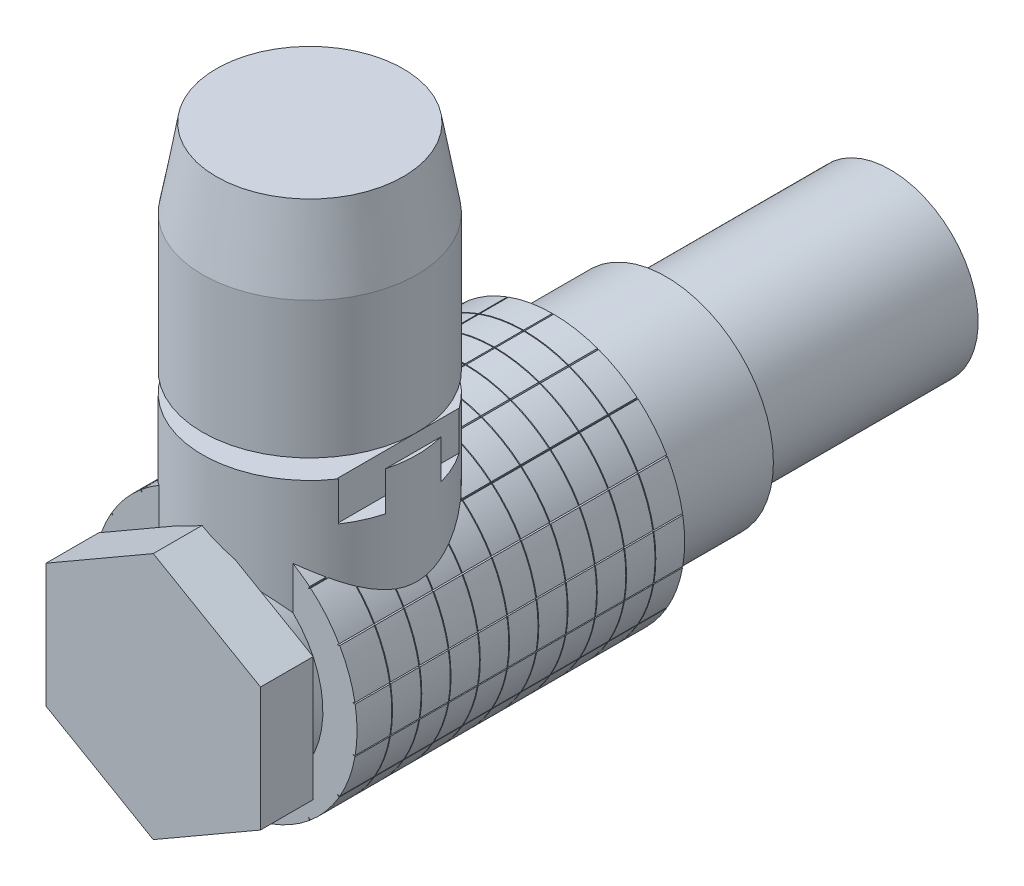
from build123d import *

# Parameters (mm, degrees)
ESQUISSE1_R                  = 6.75
EXTRUSION1_DEPTH             = 16.8
ESQUISSE2_R                  = 5.5
EXTRUSION2_DEPTH             = 5.8
ESQUISSE3_R                  = 4.5
EXTRUSION3_DEPTH             = 11.5
EXTRUSION4_DEPTH             = 20.758922035
R_P_TITION_CIRCULAIRE1_COUNT = 18
R_P_TITION_LIN_AIRE1_COUNT   = 10
R_P_TITION_LIN_AIRE1_PITCH   = 1.5
ESQUISSE6_R                  = 4
EXTRUSION5_DEPTH             = 11
EXTRUSION6_DEPTH             = 3.7
ESQUISSE8_OUTSIDE_W          = 23.97
ESQUISSE8_OUTSIDE_H          = 23.97
ESQUISSE8_OUTSIDE_R          = 5
EXTRUSION7_DEPTH             = 1
ESQUISSE9_R                  = 5.5
EXTRUSION8_DEPTH             = 21.5
CHANFREIN1_SIZE              = 4
CHANFREIN1_SIZE2             = 0.705307923
ESQUISSE10_OUTSIDE_W         = 25.316
ESQUISSE10_OUTSIDE_H         = 49.616
ESQUISSE10_OUTSIDE_R         = 4
EXTRUSION9_DEPTH             = 1
ESQUISSE11_W                 = 0.968517431
ESQUISSE11_H                 = 7.374449869
ESQUISSE11_W_2               = 0.811331263
ESQUISSE11_H_2               = 8.407812271
EXTRUSION10_DEPTH            = 2


with BuildPart() as part:
    # Esquisse1 → Extrusion1 (new body)
    with BuildSketch(Plane.XY):
        Circle(ESQUISSE1_R)
    extrude(amount=EXTRUSION1_DEPTH)

    # Esquisse2 → Extrusion2 (add)
    with BuildSketch(Plane(origin=(0, 0, 0), x_dir=(-1, 0, 0), z_dir=(0, 0, -1))):
        Circle(ESQUISSE2_R)
    extrude(amount=EXTRUSION2_DEPTH)

    # Esquisse3 → Extrusion3 (add)
    with BuildSketch(Plane(origin=(0, 0, -5.8), x_dir=(-1, 0, 0), z_dir=(0, 0, -1))):
        Circle(ESQUISSE3_R)
    extrude(amount=EXTRUSION3_DEPTH)

    # Esquisse4 → Extrusion4 (cut, through all)
    with BuildSketch(Plane(origin=(0, 0, 0), x_dir=(-1, 0, 0), z_dir=(0, 0, -1))):
        Polygon((0, 6.625), (-0.046320049, 6.797868778), (0.046320049, 6.797868778), align=None)
    extrusion4 = extrude(amount=-EXTRUSION4_DEPTH, mode=Mode.SUBTRACT)

    # Répétition circulaire1: Extrusion4 ×18 about axis
    r_p_tition_circulaire1_axis = Axis((0, 0, 16.8), (0, 0, -1))
    for i in range(1, R_P_TITION_CIRCULAIRE1_COUNT):
        add(extrusion4.rotate(r_p_tition_circulaire1_axis, i * 360 / R_P_TITION_CIRCULAIRE1_COUNT), mode=Mode.SUBTRACT)

    # Esquisse5 → Enlèvement de matière-Révolution1 (revolve, cut)
    with BuildSketch(Plane(origin=(0, 0, 0), x_dir=(0, 0, -1), z_dir=(1, 0, 0))):
        Polygon((-1.5, 6.674946277), (-1.46719308, 6.797383371), (-1.53280692, 6.797383371), align=None)
    enl_vement_de_mati_re_r_volution1 = revolve(axis=Axis((0, 0, 16.8), (0, 0, -1)), mode=Mode.SUBTRACT)

    # Répétition linéaire1: Enlèvement de matière-Révolution1 ×10
    with Locations(*[(0, 0, i * R_P_TITION_LIN_AIRE1_PITCH) for i in range(1, R_P_TITION_LIN_AIRE1_COUNT)]):
        add(enl_vement_de_mati_re_r_volution1, mode=Mode.SUBTRACT)

    # Esquisse6 → Extrusion5 (cut)
    with BuildSketch(Plane(origin=(0, 0, -17.3), x_dir=(-1, 0, 0), z_dir=(0, 0, -1))):
        Circle(ESQUISSE6_R)
    extrude(amount=-EXTRUSION5_DEPTH, mode=Mode.SUBTRACT)

    # Esquisse7 → Extrusion6 (add)
    with BuildSketch(Plane.XY.offset(16.8)):
        Polygon((0, 6.350852961), (-5.5, 3.175426481), (-5.5, -3.175426481), (0, -6.350852961), (5.5, -3.175426481), (5.5, 3.175426481), align=None)
    extrude(amount=EXTRUSION6_DEPTH)

    # Esquisse8 outside → Extrusion7 (cut)
    with BuildSketch(Plane.XY.offset(16.8)):
        Rectangle(ESQUISSE8_OUTSIDE_W, ESQUISSE8_OUTSIDE_H)
        Circle(ESQUISSE8_OUTSIDE_R, mode=Mode.SUBTRACT)
    extrude(amount=EXTRUSION7_DEPTH, mode=Mode.SUBTRACT)

    # Esquisse9 → Extrusion8 (add)
    with BuildSketch(Plane(origin=(0, 0, 0), x_dir=(1, 0, 0), z_dir=(0, 1, 0))):
        with Locations((0.026780524, -12.5)):
            Circle(ESQUISSE9_R)
    extrude(amount=EXTRUSION8_DEPTH)

    # Chanfrein1
    chanfrein1_edges = [part.edges().sort_by_distance(p)[0] for p in [
        (-5.473219476, 21.5, 12.5),
    ]]
    chanfrein1_side = [part.faces().sort_by_distance(p)[0] for p in [
        (-5.473219476, 12.556627152, 12.5),
    ]]
    chamfer(chanfrein1_edges, length=CHANFREIN1_SIZE, length2=CHANFREIN1_SIZE2, reference=chanfrein1_side[0])

    # Esquisse10 outside → Extrusion9 (cut)
    with BuildSketch(Plane(origin=(0, 10.5, 0), x_dir=(-1, 0, 0), z_dir=(0, 1, 0))):
        with Locations((0, 1.6)):
            Rectangle(ESQUISSE10_OUTSIDE_W, ESQUISSE10_OUTSIDE_H)
        with Locations((-0.026780524, 12.026809314)):
            Circle(ESQUISSE10_OUTSIDE_R, mode=Mode.SUBTRACT)
    extrude(amount=-EXTRUSION9_DEPTH, mode=Mode.SUBTRACT)

    # Esquisse11 → Extrusion10 (cut)
    with BuildSketch(Plane(origin=(0, 9.5, 0), x_dir=(1, 0, 0), z_dir=(0, 1, 0))):
        with Locations((-4.957478191, -11.900803776)):
            Rectangle(ESQUISSE11_W, ESQUISSE11_H)
        with Locations((4.932446156, -11.384122575)):
            Rectangle(ESQUISSE11_W_2, ESQUISSE11_H_2)
    extrude(amount=-EXTRUSION10_DEPTH, mode=Mode.SUBTRACT)


solid = part.part
